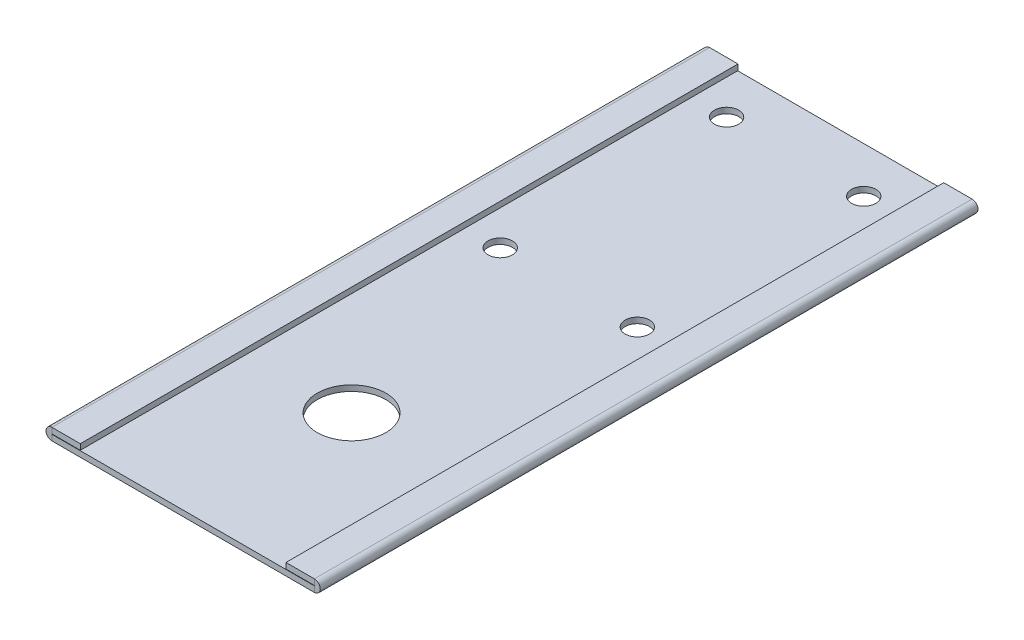
from build123d import *

# Parameters (mm, degrees)
SKETCH1_W          = 76.2
SKETCH1_H          = 182.7422304
BASE_FLANGE1_DEPTH = 1.5875
CUT_EXTRUDE1_REACH = 199.999
SKETCH6_R          = 3.3782
SKETCH7_R          = 9.525
CUT_EXTRUDE2_DEPTH = 198.999199311
HEM1_START         = -182.7422304
HEM1_DEPTH         = 182.7422304
HEM1_2_DEPTH       = 182.7422304


# Read off the part's stored shape, not the designer's step: Hem1
# Sheet-metal steps are written as plain solids
with BuildPart() as part:
    # Sketch1 → Base-Flange1 (new body)
    with BuildSketch(Plane(origin=(0, 0, 0), x_dir=(1, 0, 0), z_dir=(0, 1, 0))):
        with Locations((-38.1, 91.3711152)):
            Rectangle(SKETCH1_W, SKETCH1_H)
    extrude(amount=-BASE_FLANGE1_DEPTH)

    # Sketch6 → Cut-Extrude1 (cut, up to next)
    with BuildSketch(Plane(origin=(0, 0, 0), x_dir=(1, 0, 0), z_dir=(0, 1, 0)), mode=Mode.PRIVATE) as cut_extrude1_sk1:
        with Locations(Location((-57.15, 170.0422304, 0), (0, 0, 270))):
            Circle(SKETCH6_R)
    cut_extrude1_tool1 = extrude(cut_extrude1_sk1.sketch, amount=-CUT_EXTRUDE1_REACH, mode=Mode.PRIVATE) & part.part
    # Sketch6 → Cut-Extrude1 (cut, up to next)
    with BuildSketch(Plane(origin=(0, 0, 0), x_dir=(1, 0, 0), z_dir=(0, 1, 0)), mode=Mode.PRIVATE) as cut_extrude1_sk2:
        with Locations(Location((-19.05, 170.0422304, 0), (0, 0, 270))):
            Circle(SKETCH6_R)
    cut_extrude1_tool2 = extrude(cut_extrude1_sk2.sketch, amount=-CUT_EXTRUDE1_REACH, mode=Mode.PRIVATE) & part.part
    # Sketch6 → Cut-Extrude1 (cut, up to next)
    with BuildSketch(Plane(origin=(0, 0, 0), x_dir=(1, 0, 0), z_dir=(0, 1, 0)), mode=Mode.PRIVATE) as cut_extrude1_sk3:
        with Locations(Location((-19.05, 107.14228, 0), (0, 0, 270))):
            Circle(SKETCH6_R)
    cut_extrude1_tool3 = extrude(cut_extrude1_sk3.sketch, amount=-CUT_EXTRUDE1_REACH, mode=Mode.PRIVATE) & part.part
    # Sketch6 → Cut-Extrude1 (cut, up to next)
    with BuildSketch(Plane(origin=(0, 0, 0), x_dir=(1, 0, 0), z_dir=(0, 1, 0)), mode=Mode.PRIVATE) as cut_extrude1_sk4:
        with Locations(Location((-57.15, 107.14228, 0), (0, 0, 270))):
            Circle(SKETCH6_R)
    cut_extrude1_tool4 = extrude(cut_extrude1_sk4.sketch, amount=-CUT_EXTRUDE1_REACH, mode=Mode.PRIVATE) & part.part
    add(cut_extrude1_tool1.solids().sort_by_distance((-57.15, 0, -170.04223))[0], mode=Mode.SUBTRACT)
    add(cut_extrude1_tool2.solids().sort_by_distance((-19.05, 0, -170.04223))[0], mode=Mode.SUBTRACT)
    add(cut_extrude1_tool3.solids().sort_by_distance((-19.05, 0, -107.14228))[0], mode=Mode.SUBTRACT)
    add(cut_extrude1_tool4.solids().sort_by_distance((-57.15, 0, -107.14228))[0], mode=Mode.SUBTRACT)

    # Sketch7 → Cut-Extrude2 (cut, through all)
    with BuildSketch(Plane(origin=(0, 0, 0), x_dir=(1, 0, 0), z_dir=(0, 1, 0))):
        with Locations(Location((-38.1, 46.7957408, 0), (0, 0, 270))):
            Circle(SKETCH7_R)
    extrude(amount=-CUT_EXTRUDE2_DEPTH, mode=Mode.SUBTRACT)

    # Hem1 outline → Hem1 (cut)
    with BuildSketch(Plane.XY.offset(HEM1_START)):
        with BuildLine():
            ThreePointArc((-74.5625, -1.5875), (-75.70257264, -1.125432101), (-76.199236463, 0))
            Line((-76.199236463, 0), (-76.2, 0))
            Line((-76.2, 0), (-76.2, -1.5875))
            Line((-76.2, -1.5875), (-74.5625, -1.5875))
        make_face()
        with BuildLine():
            ThreePointArc((-0.000763537, 0), (-0.49742736, -1.125432101), (-1.6375, -1.5875))
            Line((-1.6375, -1.5875), (0, -1.5875))
            Line((0, -1.5875), (0, 0))
            Line((0, 0), (-0.000763537, 0))
        make_face()
    extrude(amount=HEM1_DEPTH, mode=Mode.SUBTRACT)

    # Hem1 2 outline → Hem1 2 (add)
    with BuildSketch(Plane.XY.offset(HEM1_START)):
        with BuildLine():
            Line((-66.675, 0.1), (-66.675, 1.6875))
            Line((-66.675, 1.6875), (-74.5625, 1.6875))
            ThreePointArc((-74.5625, 1.6875), (-75.737932101, 1.19007264), (-76.199236463, 0))
            Line((-76.199236463, 0), (-74.5625, 0))
            ThreePointArc((-74.5625, 0), (-74.6125, 0.05), (-74.5625, 0.1))
            Line((-74.5625, 0.1), (-66.675, 0.1))
        make_face()
        with BuildLine():
            ThreePointArc((-1.6375, 0.1), (-1.5875, 0.05), (-1.6375, 0))
            Line((-1.6375, 0), (-0.000763537, 0))
            ThreePointArc((-0.000763537, 0), (-0.462067899, 1.19007264), (-1.6375, 1.6875))
            Line((-1.6375, 1.6875), (-9.525, 1.6875))
            Line((-9.525, 1.6875), (-9.525, 0.1))
            Line((-9.525, 0.1), (-1.6375, 0.1))
        make_face()
    extrude(amount=HEM1_2_DEPTH)


solid = part.part
